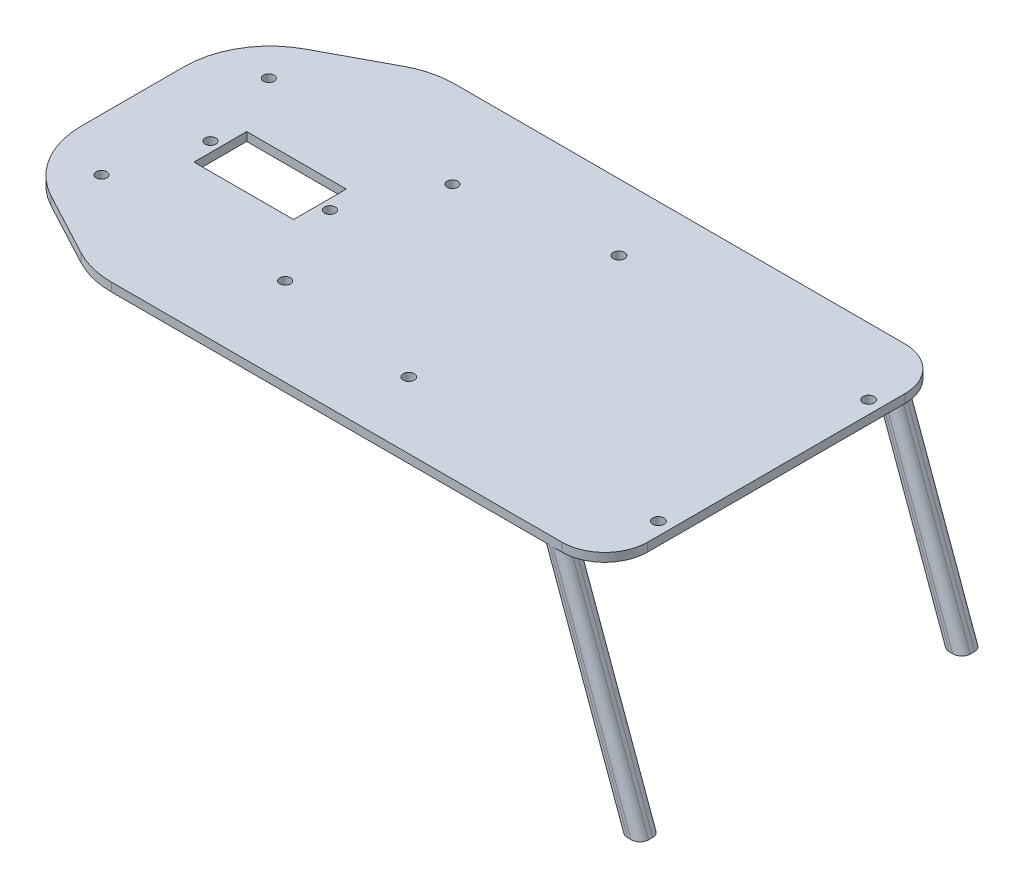
from build123d import *

# Parameters (mm, degrees)
SKETCH_1_W          = 150
SKETCH_1_H          = 80
SKETCH_1_R          = 1.25
EXTRUDE_1_DEPTH     = 2
SKETCH_2_R          = 1.3
CUT_EXTRUDE_1_DEPTH = 2
CUT_EXTRUDE_2_DEPTH = 2
FILLET_1_R          = 20
FILLET_2_R          = 10
CUT_EXTRUDE_3_REACH = 87.024
SKETCH_4_R          = 1.25
SKETCH_4_W          = 23.2
SKETCH_4_H          = 12.3
EXTRUDE_2_DEPTH     = 5
FILLET_5_R          = 2


with BuildPart() as part:
    # 草图1 → 凸台-拉伸1 (new body)
    with BuildSketch(Plane(origin=(0, 0, 0), x_dir=(1, 0, 0), z_dir=(0, 1, 0))):
        Rectangle(SKETCH_1_W, SKETCH_1_H)
        with Locations((-62.8, 19.5)):
            Circle(SKETCH_1_R, mode=Mode.SUBTRACT)
        with Locations((-20, 19.5)):
            Circle(SKETCH_1_R, mode=Mode.SUBTRACT)
        with Locations((-20, -19.5)):
            Circle(SKETCH_1_R, mode=Mode.SUBTRACT)
        with Locations((-62.8, -19.5)):
            Circle(SKETCH_1_R, mode=Mode.SUBTRACT)
    extrude(amount=EXTRUDE_1_DEPTH)

    # 草图2 → 切除-拉伸1 (cut)
    with BuildSketch(Plane(origin=(0, 2, 0), x_dir=(1, 0, 0), z_dir=(0, 1, 0))):
        with Locations((13.8, 24.5)):
            Circle(SKETCH_2_R)
        with Locations((72, 24.5)):
            Circle(SKETCH_2_R)
        with Locations((13.8, -24.5)):
            Circle(SKETCH_2_R)
        with Locations((72, -24.5)):
            Circle(SKETCH_2_R)
    extrude(amount=-CUT_EXTRUDE_1_DEPTH, mode=Mode.SUBTRACT)

    # 草图3 → 切除-拉伸2 (cut)
    with BuildSketch(Plane(origin=(0, 2, 0), x_dir=(1, 0, 0), z_dir=(0, 1, 0))):
        Polygon((-75, 40), (-45, 40), (-75, 24), align=None)
        Polygon((-45, -40), (-75, -24), (-75, -40), align=None)
    extrude(amount=-CUT_EXTRUDE_2_DEPTH, mode=Mode.SUBTRACT)

    # 圆角1
    fillet_1_edges = [part.edges().sort_by_distance(p)[0] for p in [
        (-45, 1, -40),
        (-75, 1, -24),
        (-45, 1, 40),
        (-75, 1, 24),
    ]]
    fillet(fillet_1_edges, radius=FILLET_1_R)

    # 圆角2
    fillet_2_edges = [part.edges().sort_by_distance(p)[0] for p in [
        (75, 1, -40),
        (75, 1, 40),
    ]]
    fillet(fillet_2_edges, radius=FILLET_2_R)

    # 草图4 → 切除-拉伸3 (cut, up to next)
    with BuildSketch(Plane(origin=(0, 2, 0), x_dir=(1, 0, 0), z_dir=(0, 1, 0)), mode=Mode.PRIVATE) as cut_extrude_3_sk1:
        with Locations((-29.075, 0)):
            Circle(SKETCH_4_R)
    cut_extrude_3_tool1 = extrude(cut_extrude_3_sk1.sketch, amount=-CUT_EXTRUDE_3_REACH, mode=Mode.PRIVATE) & part.part
    # 草图4 → 切除-拉伸3 (cut, up to next)
    with BuildSketch(Plane(origin=(0, 2, 0), x_dir=(1, 0, 0), z_dir=(0, 1, 0)), mode=Mode.PRIVATE) as cut_extrude_3_sk2:
        with Locations((-56.925, 0)):
            Circle(SKETCH_4_R)
    cut_extrude_3_tool2 = extrude(cut_extrude_3_sk2.sketch, amount=-CUT_EXTRUDE_3_REACH, mode=Mode.PRIVATE) & part.part
    # 草图4 → 切除-拉伸3 (cut, up to next)
    with BuildSketch(Plane(origin=(0, 2, 0), x_dir=(1, 0, 0), z_dir=(0, 1, 0)), mode=Mode.PRIVATE) as cut_extrude_3_sk3:
        with Locations((-43, 0)):
            Rectangle(SKETCH_4_W, SKETCH_4_H)
    cut_extrude_3_tool3 = extrude(cut_extrude_3_sk3.sketch, amount=-CUT_EXTRUDE_3_REACH, mode=Mode.PRIVATE) & part.part
    add(cut_extrude_3_tool1.solids().sort_by_distance((-29.075, 2, 0))[0], mode=Mode.SUBTRACT)
    add(cut_extrude_3_tool2.solids().sort_by_distance((-56.925, 2, 0))[0], mode=Mode.SUBTRACT)
    add(cut_extrude_3_tool3.solids().sort_by_distance((-43, 2, 0))[0], mode=Mode.SUBTRACT)

    # 草图5 → 凸台-拉伸2 (add)
    with BuildSketch(Plane.XY.offset(40)):
        Polygon((65, 0), (83.198511713, -50), (78.198511713, -50), (60, 0), align=None)
    extrude_2 = extrude(amount=-EXTRUDE_2_DEPTH)

    # 镜向1: 凸台-拉伸2 across plane
    add(extrude_2.mirror(Plane.XY))

    # 圆角5
    fillet_5_edges = [part.edges().sort_by_distance(p)[0] for p in [
        (69.099255857, -25, 40),
        (74.099255857, -25, 40),
        (69.099255857, -25, 35),
        (74.099255857, -25, 35),
        (74.099255857, -25, -40),
        (74.099255857, -25, -35),
        (69.099255857, -25, -35),
        (69.099255857, -25, -40),
    ]]
    fillet(fillet_5_edges, radius=FILLET_5_R)


solid = part.part
